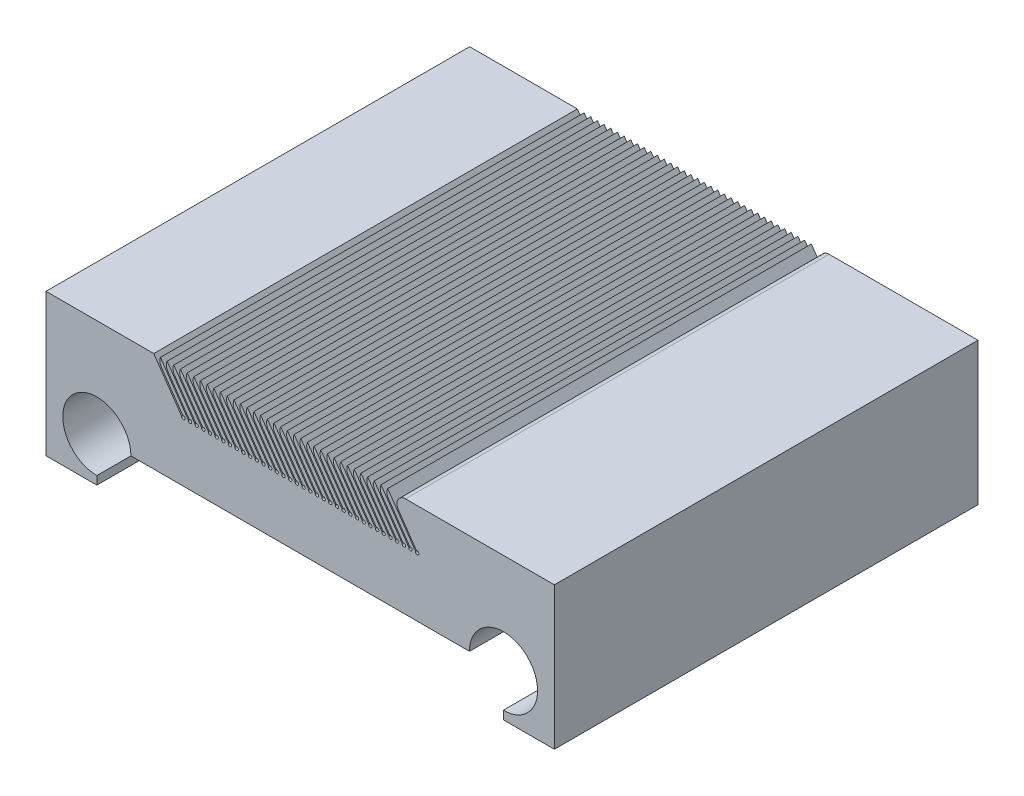
from build123d import *

# Parameters (mm, degrees)
SKETCH2_W           = 30
SKETCH2_H           = 8.406703652
BOSS_EXTRUDE1_DEPTH = 25
CUT_EXTRUDE14_DEPTH = 40.945871705
FILLET2_R           = 0.5
SKETCH2_25_R        = 0.1
CUT_EXTRUDE17_DEPTH = 40.945871705
SKETCH4_R           = 2.01
SKETCH4_W           = 23.984705643
SKETCH4_H           = 2.5
CUT_EXTRUDE20_DEPTH = 40.945871705


with BuildPart() as part:
    # Sketch2 → Boss-Extrude1 (new body)
    with BuildSketch(Plane.XY):
        with Locations((15, 4.203351826)):
            Rectangle(SKETCH2_W, SKETCH2_H)
    extrude(amount=-BOSS_EXTRUDE1_DEPTH)

    # Sketch2<21> → Cut-Extrude14 (cut, through all)
    with BuildSketch(Plane.XY):
        Polygon((6.806441903, 8.470194087), (8.451469283, 6.090294715), (8.398103744, 6.026804279), (6.753076363, 8.406703652), align=None)
        Polygon((7.200886347, 8.470194087), (8.845913727, 6.090294715), (8.792548188, 6.026804279), (7.147520808, 8.406703652), align=None)
        Polygon((7.595330792, 8.470194087), (9.240358172, 6.090294715), (9.186992633, 6.026804279), (7.541965252, 8.406703652), align=None)
        Polygon((7.989775236, 8.470194087), (9.634802616, 6.090294715), (9.581437077, 6.026804279), (7.936409697, 8.406703652), align=None)
        Polygon((8.38421968, 8.470194087), (10.029247061, 6.090294715), (9.975881522, 6.026804279), (8.330854141, 8.406703652), align=None)
        Polygon((8.778664125, 8.470194087), (10.423691505, 6.090294715), (10.370325966, 6.026804279), (8.725298586, 8.406703652), align=None)
        Polygon((9.173108569, 8.470194087), (10.81813595, 6.090294715), (10.76477041, 6.026804279), (9.11974303, 8.406703652), align=None)
        Polygon((9.567553014, 8.470194087), (11.212580394, 6.090294715), (11.159214855, 6.026804279), (9.514187475, 8.406703652), align=None)
        Polygon((9.961997458, 8.470194087), (11.607024839, 6.090294715), (11.553659299, 6.026804279), (9.908631919, 8.406703652), align=None)
        Polygon((10.356441903, 8.470194087), (12.001469283, 6.090294715), (11.948103744, 6.026804279), (10.303076363, 8.406703652), align=None)
        Polygon((10.750886347, 8.470194087), (12.395913727, 6.090294715), (12.342548188, 6.026804279), (10.697520808, 8.406703652), align=None)
        Polygon((11.145330792, 8.470194087), (12.790358172, 6.090294715), (12.736992633, 6.026804279), (11.091965252, 8.406703652), align=None)
        Polygon((11.539775236, 8.470194087), (13.184802616, 6.090294715), (13.131437077, 6.026804279), (11.486409697, 8.406703652), align=None)
        Polygon((11.93421968, 8.470194087), (13.579247061, 6.090294715), (13.525881522, 6.026804279), (11.880854141, 8.406703652), align=None)
        Polygon((12.328664125, 8.470194087), (13.973691505, 6.090294715), (13.920325966, 6.026804279), (12.275298586, 8.406703652), align=None)
        Polygon((12.723108569, 8.470194087), (14.36813595, 6.090294715), (14.31477041, 6.026804279), (12.66974303, 8.406703652), align=None)
        Polygon((13.117553014, 8.470194087), (14.762580394, 6.090294715), (14.709214855, 6.026804279), (13.064187475, 8.406703652), align=None)
        Polygon((13.511997458, 8.470194087), (15.157024839, 6.090294715), (15.103659299, 6.026804279), (13.458631919, 8.406703652), align=None)
        Polygon((13.906441903, 8.470194087), (15.551469283, 6.090294715), (15.498103744, 6.026804279), (13.853076363, 8.406703652), align=None)
        Polygon((14.300886347, 8.470194087), (15.945913727, 6.090294715), (15.892548188, 6.026804279), (14.247520808, 8.406703652), align=None)
        Polygon((14.695330792, 8.470194087), (16.340358172, 6.090294715), (16.286992633, 6.026804279), (14.641965252, 8.406703652), align=None)
        Polygon((15.089775236, 8.470194087), (16.734802616, 6.090294715), (16.681437077, 6.026804279), (15.036409697, 8.406703652), align=None)
        Polygon((15.48421968, 8.470194087), (17.129247061, 6.090294715), (17.075881522, 6.026804279), (15.430854141, 8.406703652), align=None)
        Polygon((15.878664125, 8.470194087), (17.523691505, 6.090294715), (17.470325966, 6.026804279), (15.825298586, 8.406703652), align=None)
        Polygon((16.273108569, 8.470194087), (17.91813595, 6.090294715), (17.86477041, 6.026804279), (16.21974303, 8.406703652), align=None)
        Polygon((16.667553014, 8.470194087), (18.312580394, 6.090294715), (18.259214855, 6.026804279), (16.614187475, 8.406703652), align=None)
        Polygon((17.061997458, 8.470194087), (18.707024839, 6.090294715), (18.653659299, 6.026804279), (17.008631919, 8.406703652), align=None)
        Polygon((17.850886347, 8.470194087), (19.495913727, 6.090294715), (19.442548188, 6.026804279), (17.797520808, 8.406703652), align=None)
        Polygon((18.245330792, 8.470194087), (19.890358172, 6.090294715), (19.836992633, 6.026804279), (18.191965252, 8.406703652), align=None)
        Polygon((17.456441903, 8.470194087), (19.101469283, 6.090294715), (19.048103744, 6.026804279), (17.403076363, 8.406703652), align=None)
        Polygon((18.639775236, 8.470194087), (20.284802616, 6.090294715), (20.231437077, 6.026804279), (18.586409697, 8.406703652), align=None)
        Polygon((19.03421968, 8.470194087), (20.679247061, 6.090294715), (20.625881522, 6.026804279), (18.980854141, 8.406703652), align=None)
        Polygon((19.823108569, 8.470194087), (21.46813595, 6.090294715), (21.41477041, 6.026804279), (19.76974303, 8.406703652), align=None)
        Polygon((19.428664125, 8.470194087), (21.073691505, 6.090294715), (21.020325966, 6.026804279), (19.375298586, 8.406703652), align=None)
        Polygon((20.217553014, 8.470194087), (21.862580394, 6.090294715), (21.809214855, 6.026804279), (20.164187475, 8.406703652), align=None)
        Polygon((6.431528247, 8.477112342), (8.076555627, 6.097212969), (8.003659299, 6.026804279), (6.358631919, 8.406703652), align=None)
    extrude(amount=-CUT_EXTRUDE14_DEPTH, mode=Mode.SUBTRACT)

    # Fillet2
    # the kernel refuses this fillet: 0.5 mm, written as the material it takes off along each edge
    with BuildSketch(Plane(origin=(11.583660917, 8.406703652, -26.496900919), x_dir=(0.5686034169102702, -0.8226117883169227, 0), z_dir=(0, 0, 1)), Plane(origin=(11.978105361, 8.406703652, -26.496900919), x_dir=(0.5686034169102734, -0.8226117883169204, 0), z_dir=(0, 0, 1)), Plane(origin=(10.794772028, 8.406703652, -26.496900919), x_dir=(0.568603416910272, -0.8226117883169212, 0), z_dir=(0, 0, 1)), Plane(origin=(11.189216472, 8.406703652, -26.496900919), x_dir=(0.5686034169102687, -0.8226117883169235, 0), z_dir=(0, 0, 1)), Plane(origin=(13.161438695, 8.406703652, -26.496900919), x_dir=(0.5686034169102695, -0.8226117883169232, 0), z_dir=(0, 0, 1)), Plane(origin=(13.555883139, 8.406703652, -26.496900919), x_dir=(0.5686034169102715, -0.8226117883169217, 0), z_dir=(0, 0, 1)), Plane(origin=(12.372549806, 8.406703652, -26.496900919), x_dir=(0.5686034169102702, -0.8226117883169227, 0), z_dir=(0, 0, 1)), Plane(origin=(12.76699425, 8.406703652, -26.496900919), x_dir=(0.5686034169102702, -0.8226117883169227, 0), z_dir=(0, 0, 1)), Plane(origin=(8.428105361, 8.406703652, -26.496900919), x_dir=(0.5686034169102695, -0.8226117883169232, 0), z_dir=(0, 0, 1)), Plane(origin=(8.822549806, 8.406703652, -26.496900919), x_dir=(0.5686034169102714, -0.8226117883169218, 0), z_dir=(0, 0, 1)), Plane(origin=(7.639216472, 8.406703652, -26.496900919), x_dir=(0.5686034169102695, -0.8226117883169232, 0), z_dir=(0, 0, 1)), Plane(origin=(8.033660917, 8.406703652, -26.496900919), x_dir=(0.5686034169102707, -0.8226117883169222, 0), z_dir=(0, 0, 1)), Plane(origin=(10.005883139, 8.406703652, -26.496900919), x_dir=(0.5686034169102695, -0.8226117883169232, 0), z_dir=(0, 0, 1)), Plane(origin=(10.400327583, 8.406703652, -26.496900919), x_dir=(0.5686034169102702, -0.8226117883169226, 0), z_dir=(0, 0, 1)), Plane(origin=(9.21699425, 8.406703652, -26.496900919), x_dir=(0.5686034169102694, -0.8226117883169232, 0), z_dir=(0, 0, 1)), Plane(origin=(9.611438695, 8.406703652, -26.496900919), x_dir=(0.5686034169102702, -0.8226117883169226, 0), z_dir=(0, 0, 1)), Plane(origin=(17.894772028, 8.406703652, -26.496900919), x_dir=(0.5686034169102717, -0.8226117883169217, 0), z_dir=(0, 0, 1)), Plane(origin=(18.289216472, 8.406703652, -26.496900919), x_dir=(0.5686034169102682, -0.822611788316924, 0), z_dir=(0, 0, 1)), Plane(origin=(17.105883139, 8.406703652, -26.496900919), x_dir=(0.5686034169102718, -0.8226117883169215, 0), z_dir=(0, 0, 1)), Plane(origin=(17.500327583, 8.406703652, -26.496900919), x_dir=(0.5686034169102681, -0.8226117883169242, 0), z_dir=(0, 0, 1)), Plane(origin=(19.472549806, 8.406703652, -26.496900919), x_dir=(0.5686034169102712, -0.8226117883169218, 0), z_dir=(0, 0, 1)), Plane(origin=(19.86699425, 8.406703652, -26.496900919), x_dir=(0.5686034169102696, -0.822611788316923, 0), z_dir=(0, 0, 1)), Plane(origin=(18.683660917, 8.406703652, -26.496900919), x_dir=(0.5686034169102702, -0.8226117883169227, 0), z_dir=(0, 0, 1)), Plane(origin=(19.078105361, 8.406703652, -26.496900919), x_dir=(0.5686034169102715, -0.8226117883169217, 0), z_dir=(0, 0, 1)), Plane(origin=(14.739216472, 8.406703652, -26.496900919), x_dir=(0.5686034169102689, -0.8226117883169235, 0), z_dir=(0, 0, 1)), Plane(origin=(15.133660917, 8.406703652, -26.496900919), x_dir=(0.5686034169102708, -0.8226117883169222, 0), z_dir=(0, 0, 1)), Plane(origin=(13.950327583, 8.406703652, -26.496900919), x_dir=(0.5686034169102688, -0.8226117883169235, 0), z_dir=(0, 0, 1)), Plane(origin=(14.344772028, 8.406703652, -26.496900919), x_dir=(0.5686034169102687, -0.8226117883169235, 0), z_dir=(0, 0, 1)), Plane(origin=(16.31699425, 8.406703652, -26.496900919), x_dir=(0.5686034169102713, -0.8226117883169218, 0), z_dir=(0, 0, 1)), Plane(origin=(16.711438695, 8.406703652, -26.496900919), x_dir=(0.5686034169102686, -0.8226117883169236, 0), z_dir=(0, 0, 1)), Plane(origin=(15.528105361, 8.406703652, -26.496900919), x_dir=(0.5686034169102705, -0.8226117883169223, 0), z_dir=(0, 0, 1)), Plane(origin=(15.922549806, 8.406703652, -26.496900919), x_dir=(0.5686034169102695, -0.8226117883169232, 0), z_dir=(0, 0, 1)), Plane(origin=(7.244772028, 8.406703652, -26.496900919), x_dir=(0.5686034169102707, -0.8226117883169222, 0), z_dir=(0, 0, 1)), Plane(origin=(6.850327583, 8.406703652, -26.496900919), x_dir=(0.5686034169102697, -0.8226117883169229, 0), z_dir=(0, 0, 1))) as fillet2_piece_1:
        with BuildLine():
            CenterArc((0.598760368, 0.5), FILLET2_R, 210.733841736, 59.266158264)
            Line((0.168985083, 0.24447465), (0.160389577, 0.239364143))
            ThreePointArc((0.160389577, 0.239364143), (0.076266424, 0.127923359), (-0.008226118, 0.005686034))
            Line((-0.008226118, 0.005686034), (0, -0.01))
            Line((0, -0.01), (0.598760368, -0.01))
            Line((0.598760368, -0.01), (0.598760368, 0))
        make_face()
    extrude(amount=27.993801838, mode=Mode.SUBTRACT)
    with BuildSketch(Plane(origin=(6.480195944, 8.406703652, -26.430991553), x_dir=(0.5686034169102704, -0.8226117883169225, 0), z_dir=(0, 0, 1))) as fillet2_piece_2:
        with BuildLine():
            CenterArc((0.572396621, 0.5), FILLET2_R, 213.439125299, 56.560874701)
            Line((0.155160739, 0.22447465), (0.146816021, 0.218964143))
            ThreePointArc((0.146816021, 0.218964143), (0.069354252, 0.117923359), (-0.008226118, 0.005686034))
            Line((-0.008226118, 0.005686034), (0, -0.01))
            Line((0, -0.01), (0.572396621, -0.01))
            Line((0.572396621, -0.01), (0.572396621, 0))
        make_face()
    extrude(amount=27.861983106, mode=Mode.SUBTRACT)
    with BuildSketch(Plane(origin=(20.261438695, 8.406703652, -27.383571812), x_dir=(1, 0, 0), z_dir=(0, 0, 1))) as fillet2_piece_3:
        with BuildLine():
            CenterArc((FILLET2_R * 1.90685744988, -FILLET2_R), FILLET2_R, 90, 124.652895077)
            Line((FILLET2_R * 1.08424566156, -FILLET2_R * 1.56860341691), (FILLET2_R * 1.0677934258, -FILLET2_R * 1.57997548525))
            Line((FILLET2_R * 1.0677934258, -FILLET2_R * 1.57997548525), (-FILLET2_R * 0.0164522357663, -FILLET2_R * 0.0113720683382))
            Line((-FILLET2_R * 0.0164522357663, -FILLET2_R * 0.0113720683382), (0, FILLET2_R * 0.02))
            Line((0, FILLET2_R * 0.02), (FILLET2_R * 1.90685744988, FILLET2_R * 0.02))
            Line((FILLET2_R * 1.90685744988, FILLET2_R * 0.02), (FILLET2_R * 1.90685744988, 0))
        make_face()
    extrude(amount=29.767143625, mode=Mode.SUBTRACT)

    # Sketch2<25> → Cut-Extrude17 (cut, through all)
    with BuildSketch(Plane.XY):
        with Locations((8.494444444, 6)):
            Circle(SKETCH2_25_R)
        with Locations((8.888888889, 6)):
            Circle(SKETCH2_25_R)
        with Locations((9.283333333, 6)):
            Circle(SKETCH2_25_R)
        with Locations((9.677777778, 6)):
            Circle(SKETCH2_25_R)
        with Locations((10.072222222, 6)):
            Circle(SKETCH2_25_R)
        with Locations((10.466666667, 6)):
            Circle(SKETCH2_25_R)
        with Locations((10.861111111, 6)):
            Circle(SKETCH2_25_R)
        with Locations((11.255555556, 6)):
            Circle(SKETCH2_25_R)
        with Locations((11.65, 6)):
            Circle(SKETCH2_25_R)
        with Locations((12.044444444, 6)):
            Circle(SKETCH2_25_R)
        with Locations((12.438888889, 6)):
            Circle(SKETCH2_25_R)
        with Locations((12.833333333, 6)):
            Circle(SKETCH2_25_R)
        with Locations((13.227777778, 6)):
            Circle(SKETCH2_25_R)
        with Locations((13.622222222, 6)):
            Circle(SKETCH2_25_R)
        with Locations((14.016666667, 6)):
            Circle(SKETCH2_25_R)
        with Locations((14.411111111, 6)):
            Circle(SKETCH2_25_R)
        with Locations((14.805555556, 6)):
            Circle(SKETCH2_25_R)
        with Locations((15.2, 6)):
            Circle(SKETCH2_25_R)
        with Locations((15.594444444, 6)):
            Circle(SKETCH2_25_R)
        with Locations((15.988888889, 6)):
            Circle(SKETCH2_25_R)
        with Locations((16.383333333, 6)):
            Circle(SKETCH2_25_R)
        with Locations((16.777777778, 6)):
            Circle(SKETCH2_25_R)
        with Locations((17.172222222, 6)):
            Circle(SKETCH2_25_R)
        with Locations((17.566666667, 6)):
            Circle(SKETCH2_25_R)
        with Locations((17.961111111, 6)):
            Circle(SKETCH2_25_R)
        with Locations((18.355555556, 6)):
            Circle(SKETCH2_25_R)
        with Locations((18.75, 6)):
            Circle(SKETCH2_25_R)
        with Locations((19.538888889, 6)):
            Circle(SKETCH2_25_R)
        with Locations((19.933333333, 6)):
            Circle(SKETCH2_25_R)
        with Locations((19.144444444, 6)):
            Circle(SKETCH2_25_R)
        with Locations((20.327777778, 6)):
            Circle(SKETCH2_25_R)
        with Locations((20.722222222, 6)):
            Circle(SKETCH2_25_R)
        with Locations((21.511111111, 6)):
            Circle(SKETCH2_25_R)
        with Locations((21.116666667, 6)):
            Circle(SKETCH2_25_R)
        with Locations((21.905555556, 6)):
            Circle(SKETCH2_25_R)
        with Locations((8.1, 6)):
            Circle(SKETCH2_25_R)
    extrude(amount=-CUT_EXTRUDE17_DEPTH, mode=Mode.SUBTRACT)

    # Sketch4 → Cut-Extrude20 (cut, through all)
    with BuildSketch(Plane.XY):
        with BuildLine():
            Line((5.01, 2.5), (3, 2.5))
            Line((3, 2.5), (3, 0.49))
            ThreePointArc((3, 0.49), (4.42128463, 1.07871537), (5.01, 2.5))
        make_face()
        with BuildLine():
            Line((3, 0.49), (3, 2.5))
            Line((3, 2.5), (5.01, 2.5))
            ThreePointArc((5.01, 2.5), (1.57871537, 3.92128463), (3, 0.49))
        make_face()
        with Locations((3, 2.5)):
            Circle(SKETCH4_R)
        with Locations((27, 2.5)):
            Circle(SKETCH4_R)
        with Locations((14.992352822, 1.25)):
            Rectangle(SKETCH4_W, SKETCH4_H)
        with BuildLine():
            Line((26.984705643, 2.5), (24.99, 2.5))
            ThreePointArc((24.99, 2.5), (25.573318245, 1.084133067), (26.984705643, 0.490058189))
            Line((26.984705643, 0.490058189), (26.984705643, 2.5))
        make_face()
        with BuildLine():
            ThreePointArc((29.01, 2.5), (27, 4.51), (24.99, 2.5))
            Line((24.99, 2.5), (26.984705643, 2.5))
            Line((26.984705643, 2.5), (26.984705643, 0.490058189))
            ThreePointArc((26.984705643, 0.490058189), (28.415866933, 1.073318245), (29.01, 2.5))
        make_face()
    extrude(amount=-CUT_EXTRUDE20_DEPTH, mode=Mode.SUBTRACT)


solid = part.part
